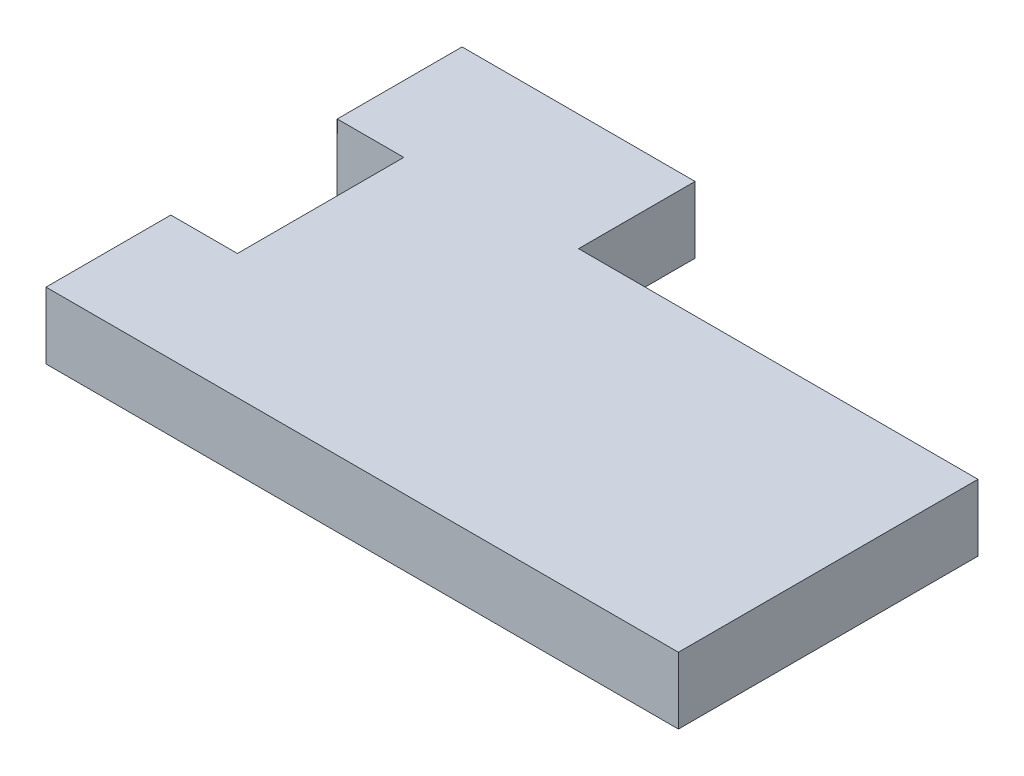
from build123d import *

# Parameters (mm, degrees)
SKETCH1_W           = 38
SKETCH1_H           = 25
BOSS_EXTRUDE1_DEPTH = 4
SKETCH2_W           = 24
SKETCH2_H           = 7
CUT_EXTRUDE1_DEPTH  = 46.661800227
SKETCH3_W           = 4
SKETCH3_H           = 10
CUT_EXTRUDE2_DEPTH  = 46.661800227


with BuildPart() as part:
    # Sketch1 → Boss-Extrude1 (new body)
    with BuildSketch(Plane(origin=(0, 0, 0), x_dir=(1, 0, 0), z_dir=(0, 1, 0))):
        with Locations((19, -12.5)):
            Rectangle(SKETCH1_W, SKETCH1_H)
    extrude(amount=BOSS_EXTRUDE1_DEPTH)

    # Sketch2 → Cut-Extrude1 (cut, through all)
    with BuildSketch(Plane(origin=(0, 4, 0), x_dir=(1, 0, 0), z_dir=(0, 1, 0))):
        with Locations((26, -3.5)):
            Rectangle(SKETCH2_W, SKETCH2_H)
    extrude(amount=-CUT_EXTRUDE1_DEPTH, mode=Mode.SUBTRACT)

    # Sketch3 → Cut-Extrude2 (cut, through all)
    with BuildSketch(Plane.XZ):
        with Locations((2, 12.5)):
            Rectangle(SKETCH3_W, SKETCH3_H)
    extrude(amount=-CUT_EXTRUDE2_DEPTH, mode=Mode.SUBTRACT)


solid = part.part
